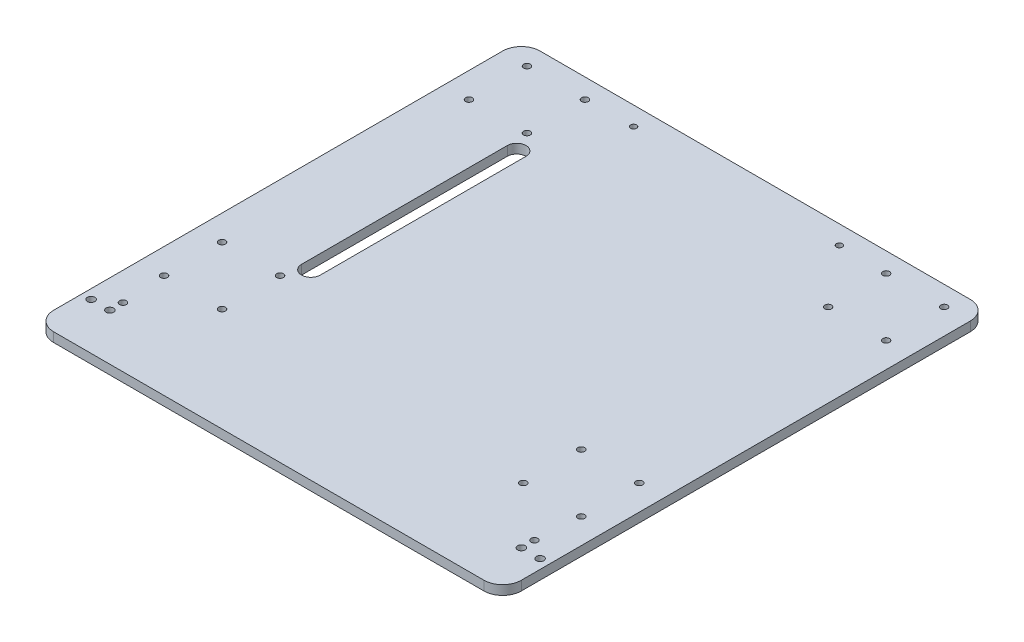
from build123d import *

# Parameters (mm, degrees)
SKETCH_1_W      = 250
SKETCH_1_H      = 260
SKETCH_1_R      = 1.8
SKETCH_1_R_2    = 2
SKETCH_1_R_3    = 1.6
EXTRUDE_1_DEPTH = 5
FILLET_2_R      = 10


with BuildPart() as part:
    # 草图1 → 凸台-拉伸1 (new body)
    with BuildSketch(Plane(origin=(0, 0, 0), x_dir=(1, 0, 0), z_dir=(0, 1, 0))):
        Rectangle(SKETCH_1_W, SKETCH_1_H)
        with Locations((-111.5, 119.5)):
            Circle(SKETCH_1_R, mode=Mode.SUBTRACT)
        with Locations((-80.5, 119.5)):
            Circle(SKETCH_1_R, mode=Mode.SUBTRACT)
        with Locations((-80.5, 88.5)):
            Circle(SKETCH_1_R, mode=Mode.SUBTRACT)
        with Locations((-111.5, 88.5)):
            Circle(SKETCH_1_R, mode=Mode.SUBTRACT)
        with Locations((-111.5, -43.5)):
            Circle(SKETCH_1_R, mode=Mode.SUBTRACT)
        with Locations((-80.5, -43.5)):
            Circle(SKETCH_1_R, mode=Mode.SUBTRACT)
        with Locations((-80.5, -74.5)):
            Circle(SKETCH_1_R, mode=Mode.SUBTRACT)
        with Locations((-111.5, -74.5)):
            Circle(SKETCH_1_R, mode=Mode.SUBTRACT)
        with Locations((111.5, -74.5)):
            Circle(SKETCH_1_R, mode=Mode.SUBTRACT)
        with Locations((80.5, -74.5)):
            Circle(SKETCH_1_R, mode=Mode.SUBTRACT)
        with Locations((80.5, -43.5)):
            Circle(SKETCH_1_R, mode=Mode.SUBTRACT)
        with Locations((111.5, -43.5)):
            Circle(SKETCH_1_R, mode=Mode.SUBTRACT)
        with Locations((111.5, 88.5)):
            Circle(SKETCH_1_R, mode=Mode.SUBTRACT)
        with Locations((80.5, 88.5)):
            Circle(SKETCH_1_R, mode=Mode.SUBTRACT)
        with Locations((80.5, 119.5)):
            Circle(SKETCH_1_R, mode=Mode.SUBTRACT)
        with Locations((111.5, 119.5)):
            Circle(SKETCH_1_R, mode=Mode.SUBTRACT)
        with Locations((-120, -105)):
            Circle(SKETCH_1_R_2, mode=Mode.SUBTRACT)
        with Locations((-110, -105)):
            Circle(SKETCH_1_R_2, mode=Mode.SUBTRACT)
        with Locations((110, -105)):
            Circle(SKETCH_1_R_2, mode=Mode.SUBTRACT)
        with Locations((120, -105)):
            Circle(SKETCH_1_R_2, mode=Mode.SUBTRACT)
        with Locations((-55, 120)):
            Circle(SKETCH_1_R_3, mode=Mode.SUBTRACT)
        with Locations((55, 120)):
            Circle(SKETCH_1_R_3, mode=Mode.SUBTRACT)
        with Locations((-110, -98)):
            Circle(SKETCH_1_R, mode=Mode.SUBTRACT)
        with Locations((110, -98)):
            Circle(SKETCH_1_R, mode=Mode.SUBTRACT)
        with BuildLine():
            Line((-70, 77.5), (-70, -32.5))
            ThreePointArc((-70, -32.5), (-75, -37.5), (-80, -32.5))
            Line((-80, -32.5), (-80, 77.5))
            ThreePointArc((-80, 77.5), (-75, 82.5), (-70, 77.5))
        make_face(mode=Mode.SUBTRACT)
    extrude(amount=EXTRUDE_1_DEPTH)

    # 圆角2
    fillet_2_edges = [part.edges().sort_by_distance(p)[0] for p in [
        (125, 2.5, -130),
        (125, 2.5, 130),
        (-125, 2.5, -130),
        (-125, 2.5, 130),
    ]]
    fillet(fillet_2_edges, radius=FILLET_2_R)


solid = part.part
